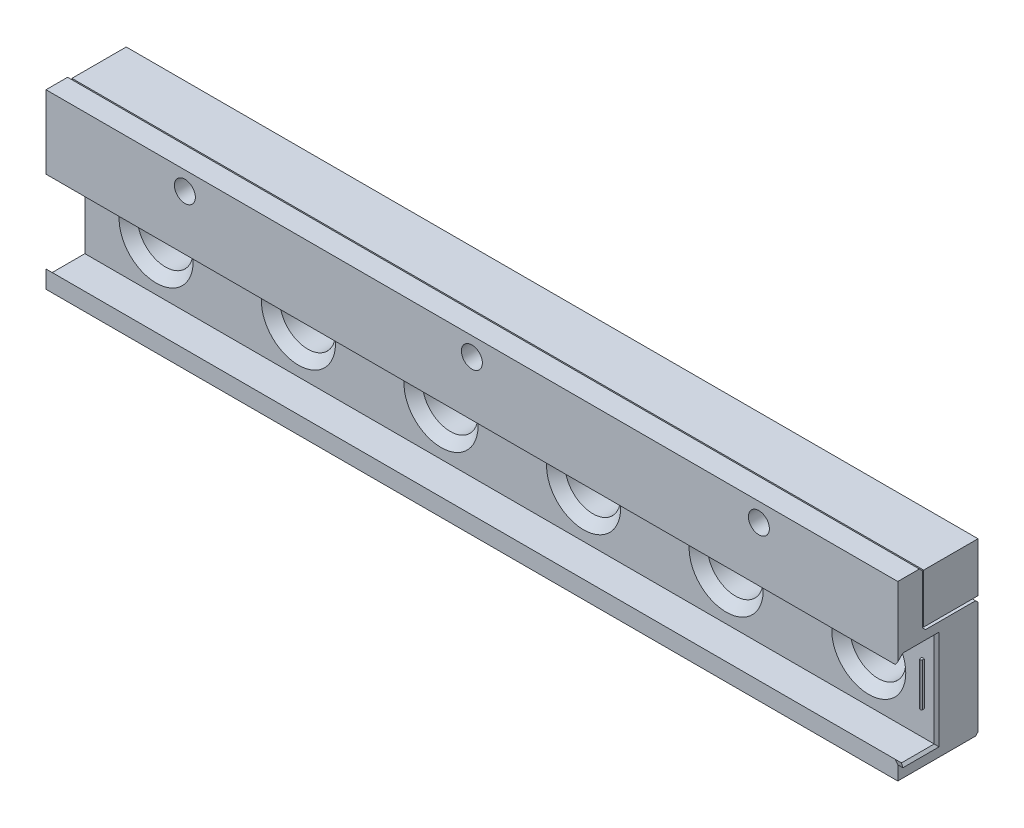
from build123d import *

# Parameters (mm, degrees)
SKETCH1_W            = 138
SKETCH1_H            = 19
BOSS_EXTRUDE1_DEPTH  = 13
SKETCH2_R            = 4.5
CUT_EXTRUDE1_DEPTH   = 111.877719725
SKETCH4_R            = 4.5
CUT_EXTRUDE2_DEPTH   = 111.877719725
SKETCH5_R            = 4.5
CUT_EXTRUDE3_DEPTH   = 111.877719725
SKETCH6_R            = 4.5
CUT_EXTRUDE4_DEPTH   = 111.877719725
SKETCH7_W            = 138
SKETCH7_H            = 15.3
CUT_EXTRUDE5_DEPTH   = 6.3
SKETCH11_W           = 138
SKETCH11_H           = 4
BOSS_EXTRUDE4_DEPTH  = 9
SKETCH12_R           = 1.7
CUT_EXTRUDE6_DEPTH   = 114.290805819
SKETCH13_R           = 1.7
CUT_EXTRUDE7_DEPTH   = 114.290805819
CHAMFER1_SIZE        = 0.4
CHAMFER2_SIZE        = 0.5
CHAMFER3_SIZE        = 0.5
CHAMFER4_SIZE        = 0.5
SKETCH14_W           = 138
SKETCH14_H           = 8
BOSS_EXTRUDE5_DEPTH  = 8.8
SKETCH15_W           = 136
SKETCH15_H           = 6
CUT_EXTRUDE8_DEPTH   = 1
CHAMFER5_SIZE        = 1.5
BOSS_EXTRUDE8_DEPTH  = 138
CHAMFER6_SIZE        = 0.4
SKETCH20_W           = 0.4
SKETCH20_H           = 7
BOSS_EXTRUDE9_DEPTH  = 0.75
FILLET1_R            = 0.5
FILLET2_R            = 0.2
CHAMFER7_SIZE        = 1.5
SKETCH25_R           = 1.7
CUT_EXTRUDE9_DEPTH   = 4
CHAMFER8_SIZE        = 0.4
SKETCH26_W           = 136
SKETCH26_H           = 6
CUT_EXTRUDE10_DEPTH  = 7
BOSS_EXTRUDE10_DEPTH = 1
BOSS_EXTRUDE11_DEPTH = 1
LPATTERN1_COUNT      = 27
LPATTERN1_PITCH      = 5.2
SKETCH29_W           = 1.022633573
SKETCH29_H           = 8
CUT_EXTRUDE11_DEPTH  = 6.9
SKETCH30_W           = 1
SKETCH30_H           = 6
BOSS_EXTRUDE12_DEPTH = 7
LPATTERN2_COUNT      = 33
LPATTERN2_PITCH      = 4.05
SKETCH31_R           = 2.5
BOSS_EXTRUDE13_DEPTH = 1


with BuildPart() as part:
    # Sketch1 → Boss-Extrude1 (new body)
    with BuildSketch(Plane.XY):
        with Locations((-38.107228916, 16.052108434)):
            Rectangle(SKETCH1_W, SKETCH1_H)
    extrude(amount=BOSS_EXTRUDE1_DEPTH)

    # Sketch2 → Cut-Extrude1 (cut, through all)
    with BuildSketch(Plane.XY.offset(13)):
        with Locations((-95.557228916, 16.052108434)):
            Circle(SKETCH2_R)
    extrude(amount=-CUT_EXTRUDE1_DEPTH, mode=Mode.SUBTRACT)

    # Sketch4 → Cut-Extrude2 (cut, through all)
    with BuildSketch(Plane.XY.offset(13)):
        with Locations((-72.507228916, 16.052108434)):
            Circle(SKETCH4_R)
    extrude(amount=-CUT_EXTRUDE2_DEPTH, mode=Mode.SUBTRACT)

    # Sketch5 → Cut-Extrude3 (cut, through all)
    with BuildSketch(Plane.XY.offset(13)):
        with Locations((-49.407228916, 16.052108434)):
            Circle(SKETCH5_R)
    extrude(amount=-CUT_EXTRUDE3_DEPTH, mode=Mode.SUBTRACT)

    # Sketch6 → Cut-Extrude4 (cut, through all)
    with BuildSketch(Plane.XY.offset(13)):
        with Locations((-26.307228916, 16.052108434)):
            Circle(SKETCH6_R)
        with Locations((-3.207228916, 16.052108434)):
            Circle(SKETCH6_R)
        with Locations((19.892771084, 16.052108434)):
            Circle(SKETCH6_R)
    extrude(amount=-CUT_EXTRUDE4_DEPTH, mode=Mode.SUBTRACT)

    # Sketch7 → Cut-Extrude5 (cut)
    with BuildSketch(Plane.XY.offset(13)):
        with Locations((-38.107228916, 16.052108434)):
            Rectangle(SKETCH7_W, SKETCH7_H)
    extrude(amount=-CUT_EXTRUDE5_DEPTH, mode=Mode.SUBTRACT)

    # Sketch11 → Boss-Extrude4 (add)
    with BuildSketch(Plane(origin=(0, 25.552108434, 0), x_dir=(1, 0, 0), z_dir=(0, 1, 0))):
        with Locations((-38.107228916, -11)):
            Rectangle(SKETCH11_W, SKETCH11_H)
    extrude(amount=BOSS_EXTRUDE4_DEPTH)

    # Sketch12 → Cut-Extrude6 (cut, through all)
    with BuildSketch(Plane.XY.offset(13)):
        with Locations((-84.607228916, 31.552108434)):
            Circle(SKETCH12_R)
    extrude(amount=-CUT_EXTRUDE6_DEPTH, mode=Mode.SUBTRACT)

    # Sketch13 → Cut-Extrude7 (cut, through all)
    with BuildSketch(Plane.XY.offset(13)):
        with Locations((8.392771084, 31.552108434)):
            Circle(SKETCH13_R)
    extrude(amount=-CUT_EXTRUDE7_DEPTH, mode=Mode.SUBTRACT)

    # Chamfer1
    chamfer1_edges = [part.edges().sort_by_distance(p)[0] for p in [
        (-38.107228916, 25.552108434, 0),
        (-38.107228916, 6.552108434, 0),
    ]]
    chamfer(chamfer1_edges, length=CHAMFER1_SIZE)

    # Chamfer2
    chamfer2_edges = [part.edges().sort_by_distance(p)[0] for p in [
        (-86.307228916, 31.552108434, 9),
        (6.692771084, 31.552108434, 9),
    ]]
    chamfer(chamfer2_edges, length=CHAMFER2_SIZE)

    # Chamfer3
    chamfer3_edges = [part.edges().sort_by_distance(p)[0] for p in [
        (-38.107228916, 25.552108434, 9),
    ]]
    chamfer(chamfer3_edges, length=CHAMFER3_SIZE)

    # Chamfer4
    chamfer4_edges = [part.edges().sort_by_distance(p)[0] for p in [
        (-38.107228916, 34.552108434, 9),
    ]]
    chamfer(chamfer4_edges, length=CHAMFER4_SIZE)

    # Chamfer5
    chamfer5_edges = [part.edges().sort_by_distance(p)[0] for p in [
        (-100.057228916, 16.052108434, 6.7),
        (-77.007228916, 16.052108434, 6.7),
        (-53.907228916, 16.052108434, 6.7),
        (-30.807228916, 16.052108434, 6.7),
    ]]
    chamfer(chamfer5_edges, length=CHAMFER5_SIZE)

    # Sketch19 → Boss-Extrude8 (add)
    with BuildSketch(Plane(origin=(30.892771084, 0, 0), x_dir=(0, 0, -1), z_dir=(1, 0, 0))):
        Polygon((-13, 23.702108434), (-12, 23.702108434), (-13, 22.702108434), align=None)
        Polygon((-13, 8.402108434), (-12, 8.402108434), (-13, 9.402108434), align=None)
    extrude(amount=-BOSS_EXTRUDE8_DEPTH)

    # Chamfer6
    chamfer6_edges = [part.edges().sort_by_distance(p)[0] for p in [
        (30.892771084, 23.202108434, 12.5),
        (30.892771084, 8.902108434, 12.5),
        (30.892771084, 16.052108434, 6.7),
        (30.892771084, 23.702108434, 9.35),
        (30.892771084, 8.402108434, 9.35),
    ]]
    chamfer(chamfer6_edges, length=CHAMFER6_SIZE)

    # Sketch20 → Boss-Extrude9 (add)
    with BuildSketch(Plane.XY.offset(6.7)):
        with Locations((28.692771084, 16.052108434)):
            Rectangle(SKETCH20_W, SKETCH20_H)
    extrude(amount=BOSS_EXTRUDE9_DEPTH)

    # Fillet1
    # the kernel refuses this fillet: 0.5 mm, written as the material it takes off along each edge
    with BuildSketch(Plane(origin=(28.492771084, 11.327363562, 7.45), x_dir=(0, 0, -1), z_dir=(0, 1, 0))) as fillet1_piece_1:
        with BuildLine():
            CenterArc((0.489897949, -0.5), FILLET1_R, 90, 78.463040967)
            Line((0, -0.4), (-0.009797959, -0.398))
            ThreePointArc((-0.009797959, -0.398), (-0.01, -0.2), (-0.01, 0))
            Line((-0.01, 0), (0, 0.01))
            Line((0, 0.01), (0.489897949, 0.01))
            Line((0.489897949, 0.01), (0.489897949, 0))
        make_face()
    extrude(amount=9.449489743, mode=Mode.SUBTRACT)

    # Fillet2
    # the kernel refuses this fillet: 0.2 mm, written as the material it takes off along each edge
    with BuildSketch(Plane(origin=(28.892771084, 21.133241026, 7.45), x_dir=(0, 0, -1), z_dir=(0, -1, 0))) as fillet2_piece_1:
        with BuildLine():
            CenterArc((0.48989602, -0.2), FILLET2_R, 90, 179.999631663)
            ThreePointArc((0.489894734, -0.4), (0.173668938, -0.287297318), (0, 0))
            Line((0, 0), (0.48989602, 0))
        make_face()
    extrude(amount=10.162265185, mode=Mode.SUBTRACT)

    # Chamfer7
    chamfer7_edges = [part.edges().sort_by_distance(p)[0] for p in [
        (15.392771084, 16.052108434, 6.7),
        (-7.707228916, 16.052108434, 6.7),
    ]]
    chamfer(chamfer7_edges, length=CHAMFER7_SIZE)

    # Sketch25 → Cut-Extrude9 (cut)
    with BuildSketch(Plane.XY.offset(13)):
        with Locations((-38.107228916, 31.552108434)):
            Circle(SKETCH25_R)
    extrude(amount=-CUT_EXTRUDE9_DEPTH, mode=Mode.SUBTRACT)

    # Chamfer8
    chamfer8_edges = [part.edges().sort_by_distance(p)[0] for p in [
        (-39.807228916, 31.552108434, 9),
    ]]
    chamfer(chamfer8_edges, length=CHAMFER8_SIZE)


with BuildPart() as body_2:
    # Sketch14 → Boss-Extrude5 (new body)
    with BuildSketch(Plane(origin=(0, 0, 0), x_dir=(-1, 0, 0), z_dir=(0, 0, -1))):
        with Locations((38.107228916, 30.052108434)):
            Rectangle(SKETCH14_W, SKETCH14_H)
    extrude(amount=-BOSS_EXTRUDE5_DEPTH)

    # Sketch15 → Cut-Extrude8 (cut)
    with BuildSketch(Plane.XY.offset(8.8)):
        with Locations((-38.107228916, 30.052108434)):
            Rectangle(SKETCH15_W, SKETCH15_H)
    extrude(amount=-CUT_EXTRUDE8_DEPTH, mode=Mode.SUBTRACT)

    # Sketch26 → Cut-Extrude10 (cut)
    with BuildSketch(Plane(origin=(0, 0, 0), x_dir=(-1, 0, 0), z_dir=(0, 0, -1))):
        with Locations((38.107228916, 30.052108434)):
            Rectangle(SKETCH26_W, SKETCH26_H)
    extrude(amount=-CUT_EXTRUDE10_DEPTH, mode=Mode.SUBTRACT)

    # Sketch27 → Boss-Extrude10 (add)
    with BuildSketch(Plane.XY.offset(8.8)):
        Polygon((-106.107228916, 33.052108434), (-105.107228916, 33.052108434), (-100.905983686, 27.052108434), (-101.905983686, 27.052108434), align=None)
    boss_extrude10 = extrude(amount=-BOSS_EXTRUDE10_DEPTH)

    # Sketch28 → Boss-Extrude11 (add)
    with BuildSketch(Plane.XY.offset(8.8)):
        Polygon((-106.107228916, 27.052108434), (-105.107228916, 27.052108434), (-100.905983686, 33.052108434), (-101.905983686, 33.052108434), align=None)
    boss_extrude11 = extrude(amount=-BOSS_EXTRUDE11_DEPTH)

    # LPattern1: Boss-Extrude10, Boss-Extrude11 ×27
    with Locations(*[(i * LPATTERN1_PITCH, 0, 0) for i in range(1, LPATTERN1_COUNT)]):
        add(boss_extrude10)
        add(boss_extrude11)

    # Sketch29 → Cut-Extrude11 (cut)
    with BuildSketch(Plane(origin=(30.892771084, 0, 0), x_dir=(0, 0, -1), z_dir=(1, 0, 0))):
        with Locations((-8.288683214, 30.052108434)):
            Rectangle(SKETCH29_W, SKETCH29_H)
    extrude(amount=CUT_EXTRUDE11_DEPTH, mode=Mode.SUBTRACT)

    # Sketch30 → Boss-Extrude12 (add)
    with BuildSketch(Plane(origin=(0, 0, 0), x_dir=(-1, 0, 0), z_dir=(0, 0, -1))):
        with Locations((-26.392771084, 30.052108434)):
            Rectangle(SKETCH30_W, SKETCH30_H)
    boss_extrude12 = extrude(amount=-BOSS_EXTRUDE12_DEPTH)

    # LPattern2: Boss-Extrude12 ×33
    with Locations(*[(-i * LPATTERN2_PITCH, 0, 0) for i in range(1, LPATTERN2_COUNT)]):
        add(boss_extrude12)

    # Sketch31 → Boss-Extrude13 (add)
    with BuildSketch(Plane.XY.offset(8.8)):
        with Locations((-84.607228916, 31.552108434)):
            Circle(SKETCH31_R)
        with Locations((-38.107228916, 31.552108434)):
            Circle(SKETCH31_R)
        with Locations((8.392771084, 31.552108434)):
            Circle(SKETCH31_R)
    extrude(amount=-BOSS_EXTRUDE13_DEPTH)


solid = Compound([part.part, body_2.part])
